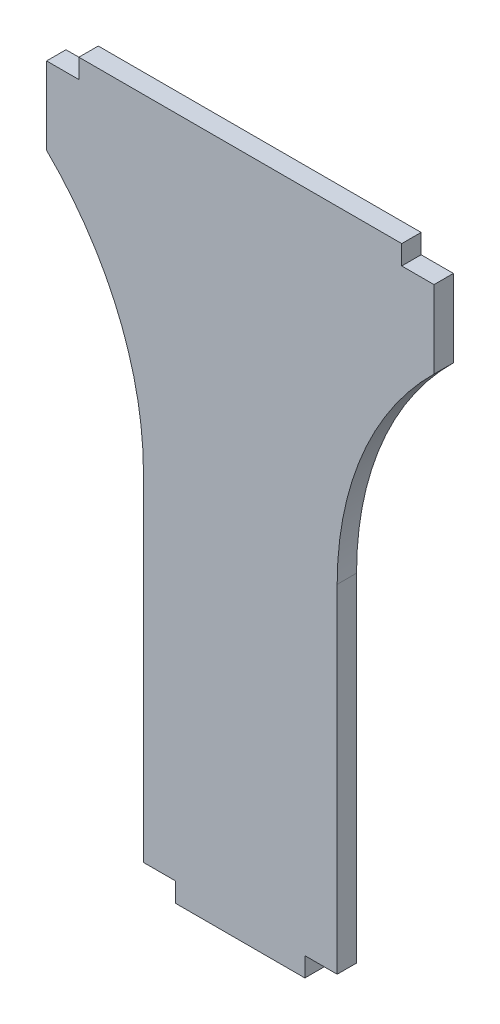
from build123d import *

# Parameters (mm, degrees)
BOSS_EXTRUDE1_DEPTH = 1.5
FILLET1_R           = 50


with BuildPart() as part:
    # Sketch2 → Boss-Extrude1 (new, symmetric)
    with BuildSketch(Plane.XY):
        Polygon((15, 44), (30, 44), (30, 56), (25, 56), (25, 59), (-25, 59), (-25, 56), (-30, 56), (-30, 44), (-15, 44), (-15, -44), (-10, -44), (-10, -47), (10, -47), (10, -44), (15, -44), align=None)
    extrude(amount=BOSS_EXTRUDE1_DEPTH, both=True)

    # Fillet1
    # the kernel refuses this fillet: 50 mm, written as the material it adds along each edge
    with BuildSketch(Plane(origin=(-15, 44, -1.5), x_dir=(0, -1, 0), z_dir=(0, 0, 1))) as fillet1_piece_1:
        with BuildLine():
            CenterArc((35.707142143, -50), FILLET1_R, 90, 45.572995999)
            Line((0, -15), (-0.714142843, -14.3))
            ThreePointArc((-0.714142843, -14.3), (-1, -7.5), (-1, 0))
            Line((-1, 0), (0, 1))
            Line((0, 1), (35.707142143, 1))
            Line((35.707142143, 1), (35.707142143, 0))
        make_face()
    extrude(amount=3)
    with BuildSketch(Plane(origin=(15, 44, 1.5), x_dir=(1, 0, 0), z_dir=(0, 0, -1))) as fillet1_piece_2:
        with BuildLine():
            CenterArc((50, 35.707142143), FILLET1_R, 180, 45.572995999)
            Line((0, 35.707142143), (-1, 35.707142143))
            Line((-1, 35.707142143), (-1, 0))
            Line((-1, 0), (0, -1))
            ThreePointArc((0, -1), (7.5, -1), (14.3, -0.714142843))
            Line((14.3, -0.714142843), (15, 0))
        make_face()
    extrude(amount=3)


solid = part.part
